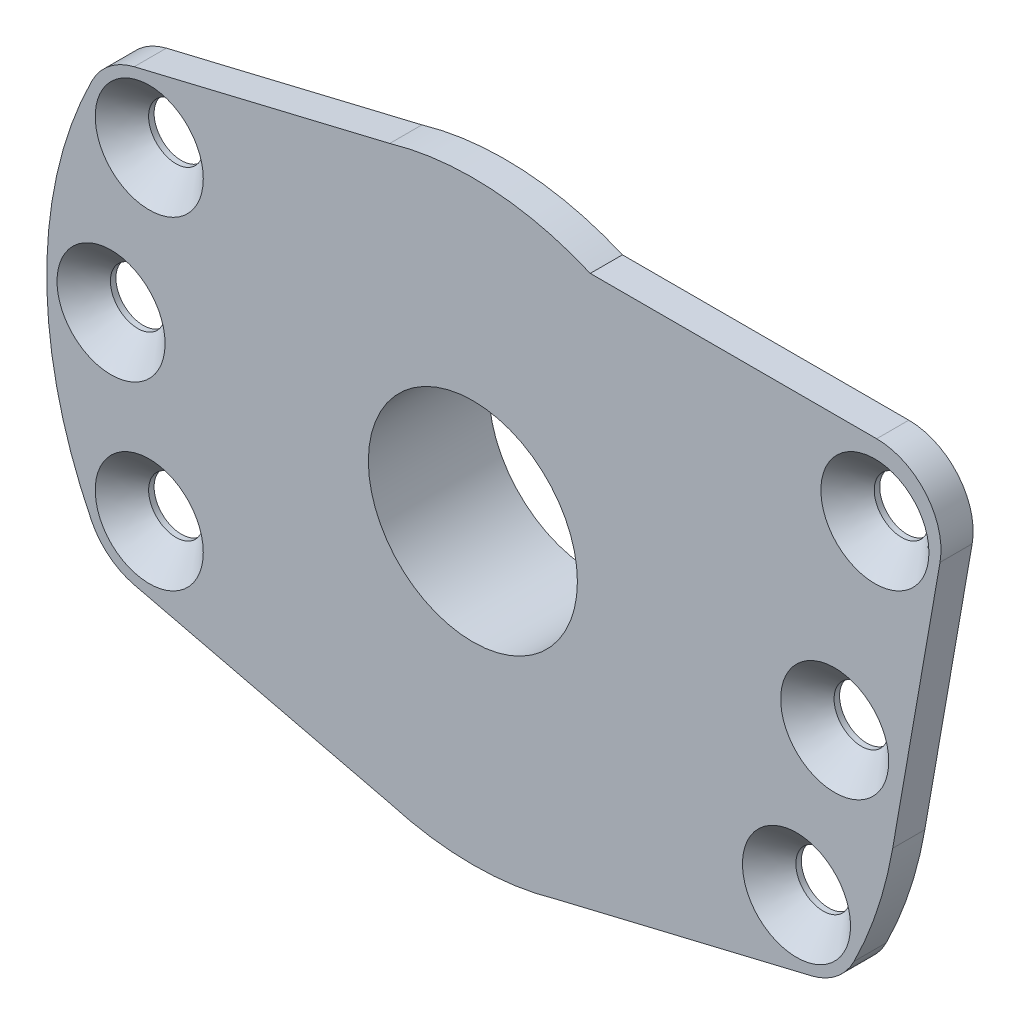
from build123d import *
from build123d.topology import SkipClean

# Parameters (mm, degrees)
SKETCH_1_R                 = 0.5
SKETCH_1_R_2               = 6.5
EXTRUDE_2_DEPTH            = 2
HOLE_WIZARD_M31_AT_2_COUNT = 2
HOLE_WIZARD_M31_AT_2_PITCH = 10.338881425
HOLE_WIZARD_M31_AT_3_COUNT = 2
HOLE_WIZARD_M31_AT_3_PITCH = 20.124611797
HOLE_WIZARD_M31_AT_4_COUNT = 2
HOLE_WIZARD_M31_AT_4_PITCH = 45
HOLE_WIZARD_M31_AT_5_COUNT = 2
HOLE_WIZARD_M31_AT_5_PITCH = 43.796204526
HOLE_WIZARD_M31_AT_6_COUNT = 2
HOLE_WIZARD_M31_AT_6_PITCH = 45.190407637
EXTRUDE_START              = 0.5
SKETCH_4_R                 = 8.5
SKETCH_4_R_2               = 6.5
EXTRUDE_3_DEPTH            = 0.5
EXTRUDE_START_2            = 5
SKETCH_5_R                 = 7.5
SKETCH_5_R_2               = 6.5
EXTRUDE_4_DEPTH            = 5


with BuildPart() as part:
    # Эскиз1 → Бобышка-Вытянуть2 (new body)
    with BuildSketch(Plane.XY):
        with BuildLine():
            Line((-5.16821295, 17.764543293), (-21.057898637, 13.951904294))
            ThreePointArc((-21.057898637, 13.951904294), (-22.612693727, 13.19430978), (-23.702320561, 11.851160281))
            ThreePointArc((-23.702320561, 11.851160281), (-26.5, 0), (-23.702320561, -11.851160281))
            ThreePointArc((-23.702320561, -11.851160281), (-22.612693727, -13.19430978), (-21.057898637, -13.951904294))
            Line((-21.057898637, -13.951904294), (-5.16821295, -17.764543293))
            ThreePointArc((-5.16821295, -17.764543293), (0, -18.50106547), (5.16821295, -17.764543293))
            Line((5.16821295, -17.764543293), (21.057898637, -13.951904294))
            ThreePointArc((21.057898637, -13.951904294), (22.612693727, -13.19430978), (23.702320561, -11.851160281))
            ThreePointArc((23.702320561, -11.851160281), (25.169556704, -8.291164895), (26.105397143, -4.556121157))
            Line((26.105397143, -4.556121157), (29.049405058, 12.312283599))
            ThreePointArc((29.049405058, 12.312283599), (28.170900607, 15.573823459), (25.108967753, 17))
            Line((25.108967753, 17), (7.299960514, 17))
            ThreePointArc((7.299960514, 17), (1.132350887, 18.466380397), (-5.16821295, 17.764543293))
        make_face()
        with Locations((25, 12.5)):
            Circle(SKETCH_1_R, mode=Mode.SUBTRACT)
        with Locations((22.5, 0)):
            Circle(SKETCH_1_R, mode=Mode.SUBTRACT)
        with Locations((20.124611797, -10.062305899)):
            Circle(SKETCH_1_R, mode=Mode.SUBTRACT)
        with Locations((-20.124611797, -10.062305899)):
            Circle(SKETCH_1_R, mode=Mode.SUBTRACT)
        with Locations((-22.5, 0)):
            Circle(SKETCH_1_R, mode=Mode.SUBTRACT)
        with Locations((-20.124611797, 10.062305899)):
            Circle(SKETCH_1_R, mode=Mode.SUBTRACT)
        Circle(SKETCH_1_R_2, mode=Mode.SUBTRACT)
    extrude(amount=EXTRUDE_2_DEPTH)

    # Эскиз3 → Зенковка для винта с потайной головкой и внутренним шестигранником M31 (revolve, cut)
    with BuildSketch(Plane(origin=(-20.124611797, 10.062305899, 2), x_dir=(0, -1, 0), z_dir=(1, 0, 0))):
        Polygon((0, 0), (0, 2), (1.7, 2), (1.7, 1.66), (3.36, 0), align=None)
    hole_wizard_m31 = revolve(axis=Axis((-20.124611797, 10.062305899, 8.35), (0, 0, -1)), mode=Mode.SUBTRACT)

    # Зенковка для винта с потайной головкой и внутренним шестигранником M31 at 2: Зенковка для винта с потайной головкой и внутренним шестигранником M31 ×2
    with Locations(*[Vector(-0.2297529205473615, -0.9732489894677301, 0) * (i * HOLE_WIZARD_M31_AT_2_PITCH) for i in range(1, HOLE_WIZARD_M31_AT_2_COUNT)]):
        add(hole_wizard_m31, mode=Mode.SUBTRACT)

    # Зенковка для винта с потайной головкой и внутренним шестигранником M31 at 3: Зенковка для винта с потайной головкой и внутренним шестигранником M31 ×2
    with Locations(*[(0, -i * HOLE_WIZARD_M31_AT_3_PITCH, 0) for i in range(1, HOLE_WIZARD_M31_AT_3_COUNT)]):
        add(hole_wizard_m31, mode=Mode.SUBTRACT)

    # Зенковка для винта с потайной головкой и внутренним шестигранником M31 at 4: Зенковка для винта с потайной головкой и внутренним шестигранником M31 ×2
    with Locations(*[Vector(0.894427190999916, -0.4472135954999578, 0) * (i * HOLE_WIZARD_M31_AT_4_PITCH) for i in range(1, HOLE_WIZARD_M31_AT_4_COUNT)]):
        add(hole_wizard_m31, mode=Mode.SUBTRACT)

    # Зенковка для винта с потайной головкой и внутренним шестигранником M31 at 5: Зенковка для винта с потайной головкой и внутренним шестигранником M31 ×2
    with Locations(*[Vector(0.9732489894677302, -0.2297529205473611, 0) * (i * HOLE_WIZARD_M31_AT_5_PITCH) for i in range(1, HOLE_WIZARD_M31_AT_5_COUNT)]):
        add(hole_wizard_m31, mode=Mode.SUBTRACT)

    # Зенковка для винта с потайной головкой и внутренним шестигранником M31 at 6: Зенковка для винта с потайной головкой и внутренним шестигранником M31 ×2
    with Locations(*[Vector(0.9985440308456991, 0.0539427331753181, 0) * (i * HOLE_WIZARD_M31_AT_6_PITCH) for i in range(1, HOLE_WIZARD_M31_AT_6_COUNT)]):
        add(hole_wizard_m31, mode=Mode.SUBTRACT)

    # Эскиз4 → Бобышка-Вытянуть3 (add)
    with SkipClean():  # the faces are left unmerged after this step: merging them gives an invalid solid
        with BuildSketch(Plane(origin=(0, 0, 0), x_dir=(-1, 0, 0), z_dir=(0, 0, -1)).offset(EXTRUDE_START)):
            Circle(SKETCH_4_R)
            Circle(SKETCH_4_R_2, mode=Mode.SUBTRACT)
        extrude(amount=-EXTRUDE_3_DEPTH)

    # Эскиз5 → Бобышка-Вытянуть4 (add)
    with SkipClean():  # the faces are left unmerged after this step: merging them gives an invalid solid
        with BuildSketch(Plane(origin=(0, 0, -0.5), x_dir=(-1, 0, 0), z_dir=(0, 0, -1)).offset(EXTRUDE_START_2)):
            Circle(SKETCH_5_R)
            Circle(SKETCH_5_R_2, mode=Mode.SUBTRACT)
        extrude(amount=-EXTRUDE_4_DEPTH)


solid = part.part
